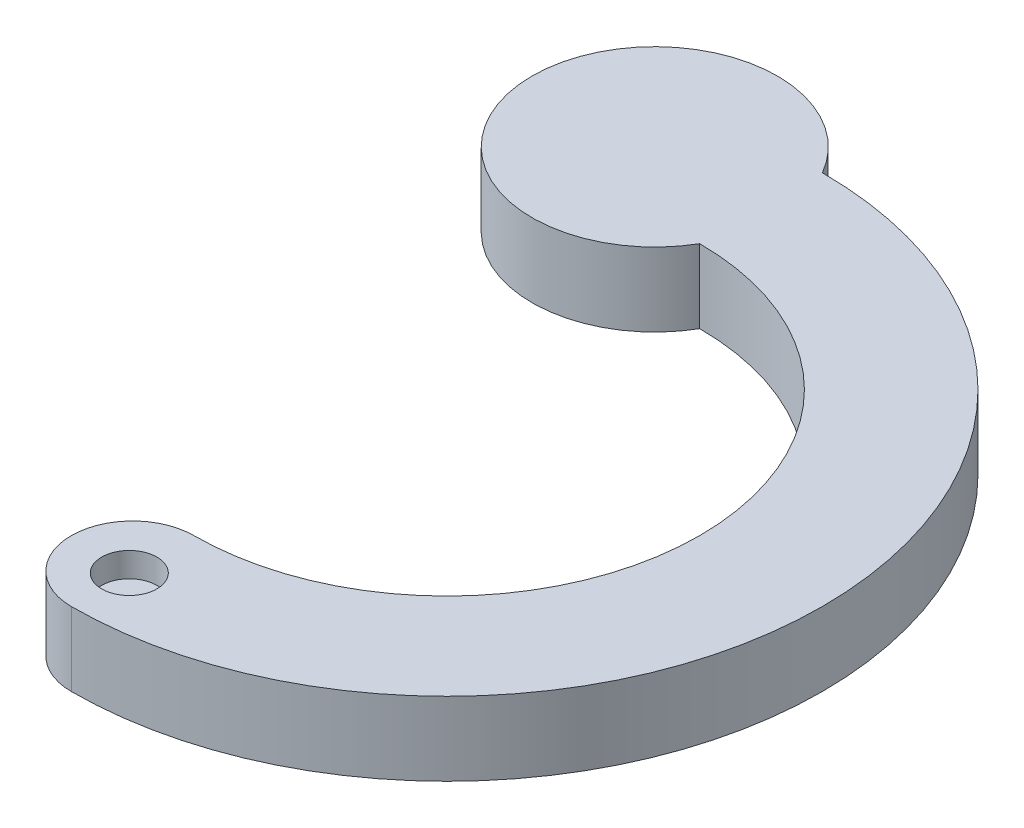
from build123d import *

# Parameters (mm, degrees)
BOSS_EXTRUDE1_DEPTH = 3
SKETCH2_R           = 2.25
CUT_EXTRUDE1_DEPTH  = 2


with BuildPart() as part:
    # Sketch1 → Boss-Extrude1 (new, symmetric)
    with BuildSketch(Plane(origin=(0, 0, 0), x_dir=(1, 0, 0), z_dir=(0, 1, 0))):
        with BuildLine():
            ThreePointArc((0, 0), (30.6, 30.6), (0, 61.2))
            ThreePointArc((0, 61.2), (-18.660254038, 56.2), (0, 51.2))
            ThreePointArc((0, 51.2), (20.599999895, 30.59999999), (-2e-08, 10))
            ThreePointArc((-2e-08, 10), (-5, 4.99999999), (0, 0))
        make_face()
    extrude(amount=BOSS_EXTRUDE1_DEPTH, both=True)

    # Sketch2 → Cut-Extrude1 (cut)
    with BuildSketch(Plane(origin=(0, 3, 0), x_dir=(1, 0, 0), z_dir=(0, 1, 0))):
        with Locations((0, 4.727516706)):
            Circle(SKETCH2_R)
    extrude(amount=-CUT_EXTRUDE1_DEPTH, mode=Mode.SUBTRACT)


solid = part.part
